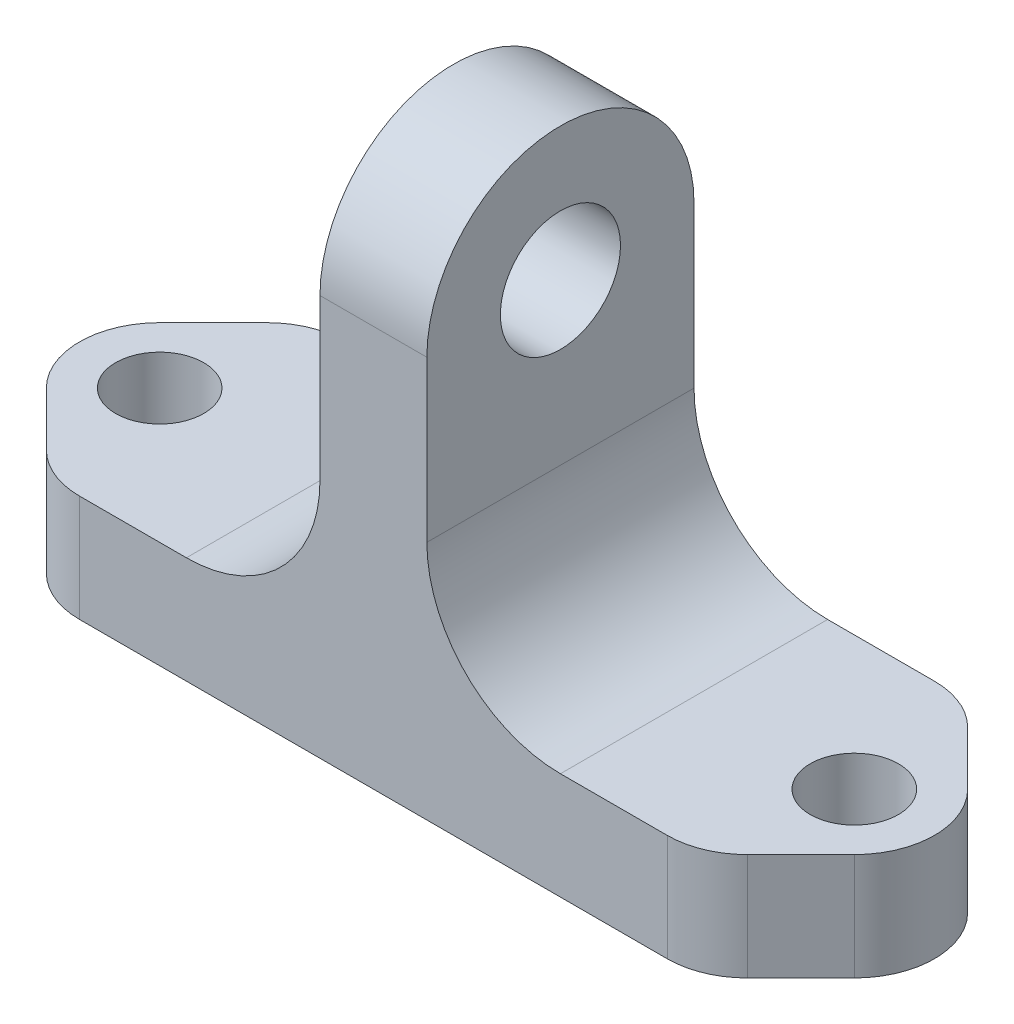
from build123d import *

# Parameters (mm, degrees)
BOSS_EXTRUDE1_DEPTH         = 5
F_3_3_3_3_DIAMETER_HOLE1_D  = 3.3
FILLET1_RADIUS              = 5
FILLET1_LENGTH              = 4
FILLET2_R                   = 5
F_16_0_177_DIAMETER_HOLE1_D = 4.4958
CUT_EXTRUDE1_DEPTH          = 4


# Read off the part's stored shape, not the designer's step: Cut-Extrude1
with BuildPart() as part:
    # Sketch1 → Boss-Extrude1 (new, symmetric)
    with BuildSketch(Plane.XY):
        Polygon((-16, 0), (16, 0), (16, 4), (2, 4), (2, 20), (-2, 20), (-2, 4), (-16, 4), align=None)
    extrude(amount=BOSS_EXTRUDE1_DEPTH, both=True)

    # Ø3.3 (3.3) Diameter Hole1 (through all)
    with Locations(Plane(origin=(0, 4, 0), x_dir=(1, 0, 0), z_dir=(0, 1, 0))):
        with Locations((-13, 0), (13, 0)):
            Hole(F_3_3_3_3_DIAMETER_HOLE1_D / 2)

    # Fillet1: full round fillet: the end face becomes a half cylinder, R = half its width
    fillet1_face = Plane((0, 20, 0), x_dir=(-1, 0, 0), z_dir=(0, 1, 0))  # on the end face: x along it, z out of the body
    fillet1_slab = fillet1_face.offset(-FILLET1_RADIUS / 2) * Box(FILLET1_LENGTH, 2 * FILLET1_RADIUS, FILLET1_RADIUS, mode=Mode.PRIVATE)  # the body's end, R deep
    fillet1_round = Plane((0, 15, 0), x_dir=(0, 1, 0), z_dir=(-1, 0, 0)) * Cylinder(FILLET1_RADIUS, FILLET1_LENGTH, mode=Mode.PRIVATE)  # its axis R under the face
    add(fillet1_slab - fillet1_round, mode=Mode.SUBTRACT)

    # Fillet2
    fillet2_edges = [part.edges().sort_by_distance(p)[0] for p in [
        (2, 4, 0),
        (-2, 4, 0),
    ]]
    fillet(fillet2_edges, radius=FILLET2_R)

    # #16 (0.177) Diameter Hole1 (through all)
    with Locations(Plane(origin=(2, 0, 0), x_dir=(0, 0, -1), z_dir=(1, 0, 0))):
        with Locations((0, 15)):
            Hole(F_16_0_177_DIAMETER_HOLE1_D / 2)

    # Cut-Extrude1 outline → Cut-Extrude1 (cut)
    with BuildSketch(Plane(origin=(0, 0, 0), x_dir=(1, 0, 0), z_dir=(0, 1, 0))):
        with BuildLine():
            Line((-16, -5), (-11, -5))
            ThreePointArc((-11, -5), (-12.148050297, -4.771638598), (-13.121320344, -4.121320344))
            Line((-13.121320344, -4.121320344), (-15.121320344, -2.121320344))
            ThreePointArc((-15.121320344, -2.121320344), (-15.771638598, -1.148050297), (-16, 0))
            Line((-16, 0), (-16, -5))
        make_face()
        with BuildLine():
            Line((-16, 5), (-16, 0))
            ThreePointArc((-16, 0), (-15.771638598, 1.148050297), (-15.121320344, 2.121320344))
            Line((-15.121320344, 2.121320344), (-13.121320344, 4.121320344))
            ThreePointArc((-13.121320344, 4.121320344), (-12.148050297, 4.771638598), (-11, 5))
            Line((-11, 5), (-16, 5))
        make_face()
    cut_extrude1 = extrude(amount=CUT_EXTRUDE1_DEPTH, mode=Mode.SUBTRACT)

    # Mirror1: Cut-Extrude1 across plane
    add(cut_extrude1.mirror(Plane(origin=(0, 0, 0), x_dir=(0, 0, 1), z_dir=(1, 0, 0))), mode=Mode.SUBTRACT)


solid = part.part
